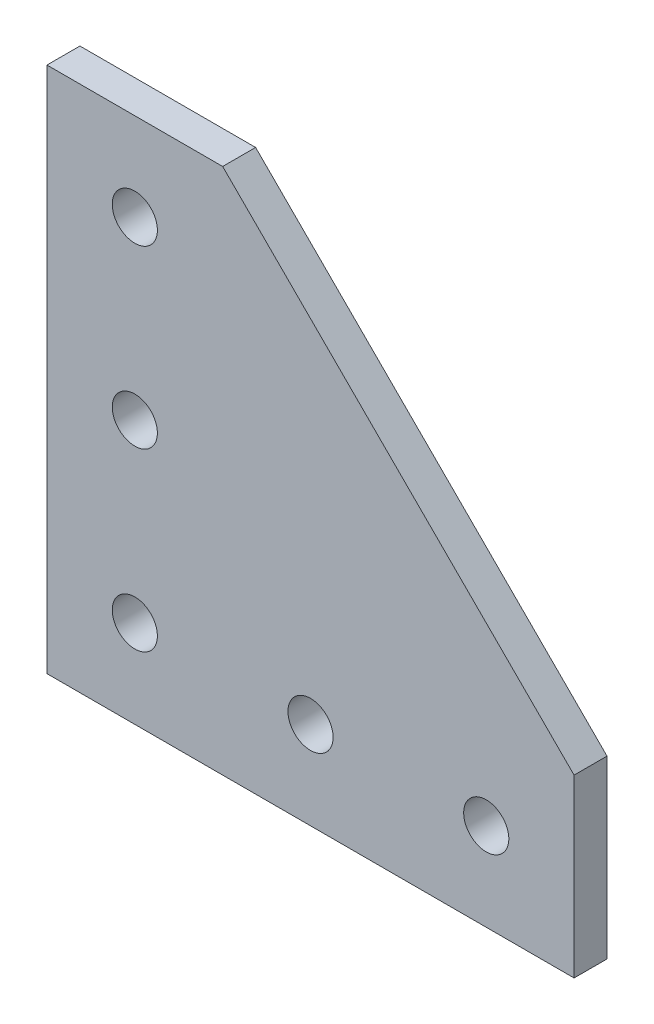
from build123d import *

# Parameters (mm, degrees)
SKETCH1_R           = 3.2639
BOSS_EXTRUDE1_DEPTH = 2.38125


with BuildPart() as part:
    # Sketch1 → Boss-Extrude1 (new, symmetric)
    with BuildSketch(Plane.XY):
        Polygon((0, 0), (0, 76.2), (25.4, 76.2), (76.2, 25.4), (76.2, 0), align=None)
        with Locations((12.7, 12.7)):
            Circle(SKETCH1_R, mode=Mode.SUBTRACT)
        with Locations((38.1, 12.7)):
            Circle(SKETCH1_R, mode=Mode.SUBTRACT)
        with Locations((63.5, 12.7)):
            Circle(SKETCH1_R, mode=Mode.SUBTRACT)
        with Locations((12.7, 38.1)):
            Circle(SKETCH1_R, mode=Mode.SUBTRACT)
        with Locations((12.7, 63.5)):
            Circle(SKETCH1_R, mode=Mode.SUBTRACT)
    extrude(amount=BOSS_EXTRUDE1_DEPTH, both=True)


solid = part.part
